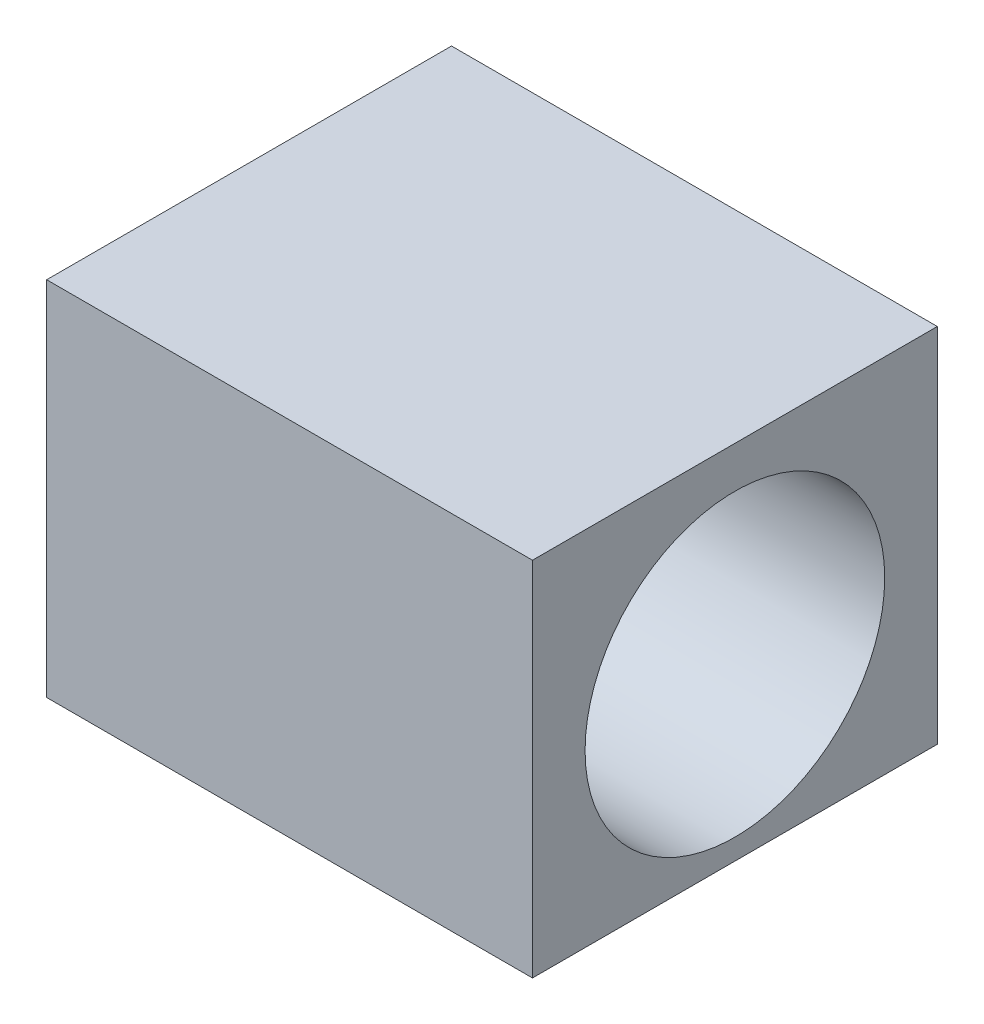
from build123d import *

# Parameters (mm, degrees)
SKETCH1_W              = 60.96
SKETCH1_H              = 50.8
BOSS_EXTRUDE1_DEPTH    = 40.64
SKETCH3_W              = 60.96
SKETCH3_H              = 50.8
BOSS_EXTRUDE2_DEPTH    = 1.5875
SKETCH2_R              = 18.8
CUT_EXTRUDE1_DEPTH     = 57.785
SKETCH4_W              = 60.96
SKETCH4_H              = 50.8
BOSS_EXTRUDE3_DEPTH    = 3.175
SKETCH6_R              = 9.144
CUT_EXTRUDE2_DEPTH     = 3.175
SKETCH7_R              = 1.5
CUT_EXTRUDE3_DEPTH     = 3.175
SKETCH8_R              = 4.7625
BOSS_EXTRUDE4_DEPTH    = 8.89
CUT_EXTRUDE4_START     = -7.1501
CUT_EXTRUDE4_OUTLINE_R = 4.7625
CUT_EXTRUDE4_DEPTH     = 0.7366
SKETCH9_R              = 4.4704
BOSS_EXTRUDE5_DEPTH    = 0.7366
SKETCH13_R             = 2.54
CUT_EXTRUDE6_DEPTH     = 3.175


# Read off the part's stored shape, not the designer's step: Cut-Extrude4
with BuildPart() as part:
    # Sketch1 → Boss-Extrude1 (new body)
    with BuildSketch(Plane(origin=(0, 0, 0), x_dir=(1, 0, 0), z_dir=(0, 1, 0))):
        Rectangle(SKETCH1_W, SKETCH1_H)
    extrude(amount=BOSS_EXTRUDE1_DEPTH)

    # Sketch3 → Boss-Extrude2 (add)
    with BuildSketch(Plane(origin=(0, 0, 0), x_dir=(-1, 0, 0), z_dir=(0, -1, 0))):
        Rectangle(SKETCH3_W, SKETCH3_H)
    extrude(amount=BOSS_EXTRUDE2_DEPTH)

    # Sketch2 → Cut-Extrude1 (cut)
    with BuildSketch(Plane(origin=(30.48, 0, 0), x_dir=(0, 0, -1), z_dir=(1, 0, 0))):
        with Locations((0, 19.812)):
            Circle(SKETCH2_R)
    extrude(amount=-CUT_EXTRUDE1_DEPTH, mode=Mode.SUBTRACT)

    # Sketch4 → Boss-Extrude3 (add)
    with BuildSketch(Plane(origin=(0, 40.64, 0), x_dir=(1, 0, 0), z_dir=(0, 1, 0))):
        Rectangle(SKETCH4_W, SKETCH4_H)
    extrude(amount=BOSS_EXTRUDE3_DEPTH)

    # Sketch6 → Cut-Extrude2 (cut)
    with BuildSketch(Plane.ZY.offset(30.48)):
        with Locations((0, 19.812)):
            Circle(SKETCH6_R)
    extrude(amount=-CUT_EXTRUDE2_DEPTH, mode=Mode.SUBTRACT)

    # Sketch7 → Cut-Extrude3 (cut)
    with BuildSketch(Plane.ZY.offset(30.48)):
        with Locations((0, 32.312000019)):
            Circle(SKETCH7_R)
        with Locations((0, 7.311999981)):
            Circle(SKETCH7_R)
    extrude(amount=-CUT_EXTRUDE3_DEPTH, mode=Mode.SUBTRACT)

    # Sketch8 → Boss-Extrude4 (add)
    with BuildSketch(Plane.XZ.offset(1.5875)):
        with Locations(Location((0, 0, 0), (0, 0, 90))):
            Circle(SKETCH8_R)
    extrude(amount=BOSS_EXTRUDE4_DEPTH)

    # Cut-Extrude4 outline → Cut-Extrude4 (cut)
    with BuildSketch(Plane(origin=(0, 0, 0), x_dir=(1, 0, 0), z_dir=(0, 1, 0)).offset(CUT_EXTRUDE4_START)):
        Circle(CUT_EXTRUDE4_OUTLINE_R)
    extrude(amount=CUT_EXTRUDE4_DEPTH, mode=Mode.SUBTRACT)

    # Sketch9 → Boss-Extrude5 (add)
    with BuildSketch(Plane(origin=(0, -6.4135, 0), x_dir=(-1, 0, 0), z_dir=(0, -1, 0))):
        with Locations(Location((0, 0, 0), (0, 0, 90))):
            Circle(SKETCH9_R)
    extrude(amount=BOSS_EXTRUDE5_DEPTH)

    # Sketch13 → Cut-Extrude6 (cut)
    with BuildSketch(Plane.ZY.offset(30.48)):
        with Locations((8.838834778, 28.650834778)):
            Circle(SKETCH13_R)
        with Locations((-8.838834778, 28.650834778)):
            Circle(SKETCH13_R)
        with Locations((-8.838834778, 10.973165222)):
            Circle(SKETCH13_R)
        with Locations((8.838834778, 10.973165222)):
            Circle(SKETCH13_R)
    extrude(amount=-CUT_EXTRUDE6_DEPTH, mode=Mode.SUBTRACT)


solid = part.part
